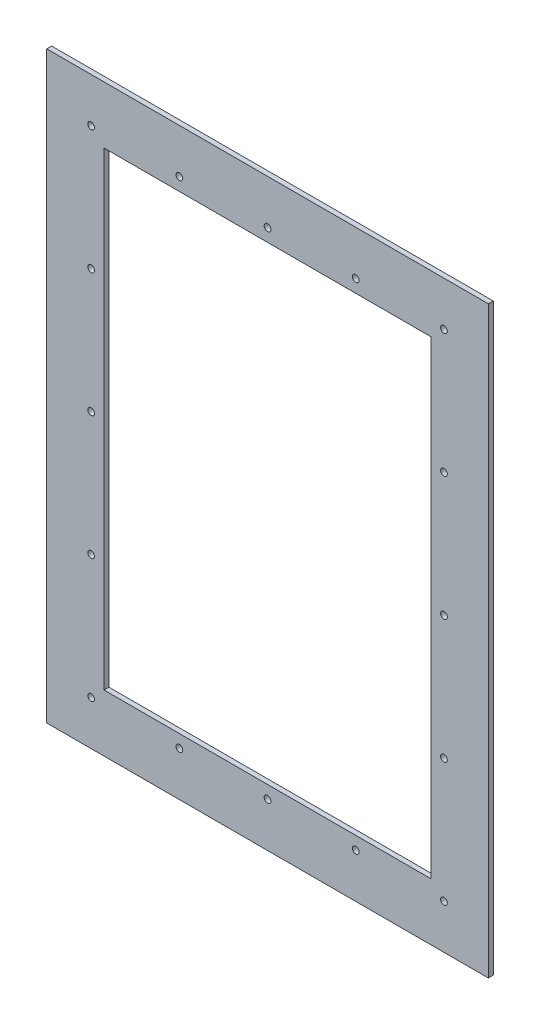
from build123d import *

# Parameters (mm, degrees)
SKETCH1_W           = 270
SKETCH1_H           = 357
SKETCH1_R           = 2.05
SKETCH1_W_2         = 200
SKETCH1_H_2         = 287
BOSS_EXTRUDE1_DEPTH = 3


with BuildPart() as part:
    # Sketch1 → Boss-Extrude1 (new body)
    with BuildSketch(Plane.XY):
        Rectangle(SKETCH1_W, SKETCH1_H)
        with Locations((-107.860879207, 151.360879207)):
            Circle(SKETCH1_R, mode=Mode.SUBTRACT)
        with Locations((-53.930439603, 151.360879207)):
            Circle(SKETCH1_R, mode=Mode.SUBTRACT)
        with Locations((-107.860879207, 75.680439603)):
            Circle(SKETCH1_R, mode=Mode.SUBTRACT)
        with Locations((-53.930439603, -151.360879207)):
            Circle(SKETCH1_R, mode=Mode.SUBTRACT)
        with Locations((-107.860879207, -151.360879207)):
            Circle(SKETCH1_R, mode=Mode.SUBTRACT)
        with Locations((-107.860879207, -75.680439603)):
            Circle(SKETCH1_R, mode=Mode.SUBTRACT)
        with Locations((53.930439603, 151.360879207)):
            Circle(SKETCH1_R, mode=Mode.SUBTRACT)
        with Locations((107.860879207, 151.360879207)):
            Circle(SKETCH1_R, mode=Mode.SUBTRACT)
        with Locations((107.860879207, 75.680439603)):
            Circle(SKETCH1_R, mode=Mode.SUBTRACT)
        with Locations((53.930439603, -151.360879207)):
            Circle(SKETCH1_R, mode=Mode.SUBTRACT)
        with Locations((107.860879207, -151.360879207)):
            Circle(SKETCH1_R, mode=Mode.SUBTRACT)
        with Locations((107.860879207, -75.680439603)):
            Circle(SKETCH1_R, mode=Mode.SUBTRACT)
        with Locations((-107.860879207, 0)):
            Circle(SKETCH1_R, mode=Mode.SUBTRACT)
        with Locations((107.860879207, 0)):
            Circle(SKETCH1_R, mode=Mode.SUBTRACT)
        with Locations((0, 151.360879207)):
            Circle(SKETCH1_R, mode=Mode.SUBTRACT)
        with Locations((0, -151.360879207)):
            Circle(SKETCH1_R, mode=Mode.SUBTRACT)
        Rectangle(SKETCH1_W_2, SKETCH1_H_2, mode=Mode.SUBTRACT)
    extrude(amount=BOSS_EXTRUDE1_DEPTH)


solid = part.part
